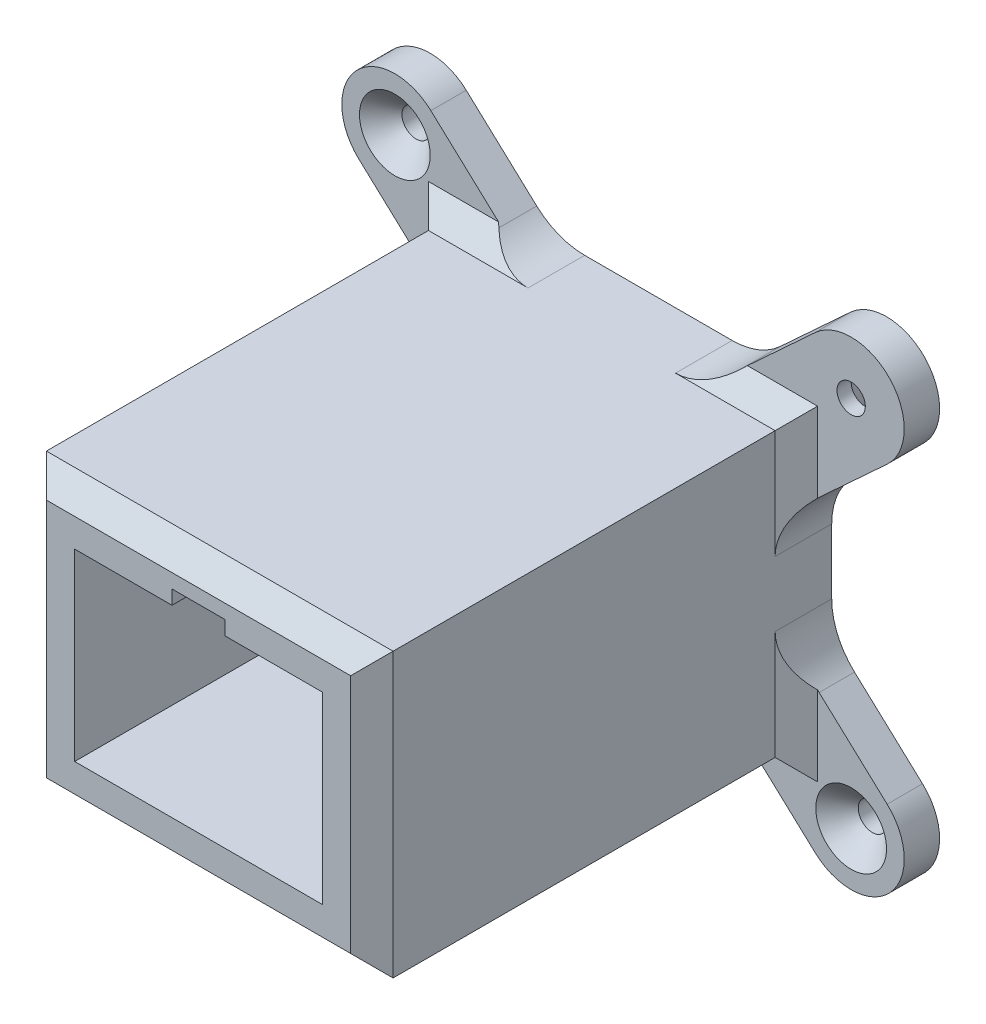
from build123d import *

# Parameters (mm, degrees)
SKETCH1_W               = 49
SKETCH1_H               = 40
BOSS_EXTRUDE1_DEPTH     = 60
SKETCH2_W               = 49
SKETCH2_H               = 40
BOSS_EXTRUDE2_DEPTH     = 5
SKETCH3_R               = 3.75
SKETCH3_W               = 8
SKETCH3_H               = 8
CUT_EXTRUDE1_DEPTH      = 4
SKETCH4_R               = 2
BOSS_EXTRUDE3_DEPTH     = 5
MIRROR2_COPY_1_SKETCH_R = 2
MIRROR2_COPY_1_DEPTH    = 5
CHAMFER2_SIZE           = 3
FILLET1_R               = 10
CHAMFER3_SIZE           = 3


with BuildPart() as part:
    # Sketch1 → Boss-Extrude1 (new body)
    with BuildSketch(Plane.XY):
        Rectangle(SKETCH1_W, SKETCH1_H)
        Polygon((-17.5, -13), (17.5, -13), (17.5, 13), (3.75, 13), (3.75, 15), (-3.75, 15), (-3.75, 13), (-17.5, 13), align=None, mode=Mode.SUBTRACT)
    extrude(amount=BOSS_EXTRUDE1_DEPTH)

    # Sketch2 → Boss-Extrude2 (add)
    with BuildSketch(Plane.XY):
        Rectangle(SKETCH2_W, SKETCH2_H)
    extrude(amount=-BOSS_EXTRUDE2_DEPTH)

    # Sketch3 → Cut-Extrude1 (cut)
    with BuildSketch(Plane.XY):
        with Locations((12, 0.25)):
            Circle(SKETCH3_R)
        with Locations((-12, 0.25)):
            Circle(SKETCH3_R)
        Rectangle(SKETCH3_W, SKETCH3_H)
    extrude(amount=-CUT_EXTRUDE1_DEPTH, mode=Mode.SUBTRACT)

    # Sketch4 → Boss-Extrude3 (add)
    with BuildSketch(Plane(origin=(0, 0, -5), x_dir=(-1, 0, 0), z_dir=(0, 0, -1))):
        with BuildLine():
            Line((27.161413951, 31.836546483), (14.329603899, 20))
            Line((14.329603899, 20), (24.5, 8.974436833))
            Line((24.5, 8.974436833), (37.331810052, 20.810983316))
            ThreePointArc((37.331810052, 20.810983316), (37.759393585, 31.40896295), (27.161413951, 31.836546483))
        make_face()
        with Locations((32.246612001, 26.323764899)):
            Circle(SKETCH4_R, mode=Mode.SUBTRACT)
    boss_extrude3 = extrude(amount=-BOSS_EXTRUDE3_DEPTH)

    # Mirror1: Boss-Extrude3 across plane
    add(boss_extrude3.mirror(Plane.ZX))

    # Mirror2: Boss-Extrude3 across plane
    add(boss_extrude3.mirror(Plane(origin=(0, 0, 0), x_dir=(0, 0, 1), z_dir=(1, 0, 0))))

    # Mirror2 copy 1 sketch → Mirror2 copy 1 (add)
    with BuildSketch(Plane(origin=(0, 0, -5), x_dir=(1, 0, 0), z_dir=(0, 0, -1))):
        with BuildLine():
            Line((27.161413951, 31.836546483), (14.329603899, 20))
            Line((14.329603899, 20), (24.5, 8.974436833))
            Line((24.5, 8.974436833), (37.331810052, 20.810983316))
            ThreePointArc((37.331810052, 20.810983316), (37.759393585, 31.40896295), (27.161413951, 31.836546483))
        make_face()
        with Locations((32.246612001, 26.323764899)):
            Circle(MIRROR2_COPY_1_SKETCH_R, mode=Mode.SUBTRACT)
    extrude(amount=-MIRROR2_COPY_1_DEPTH)

    # Chamfer2
    chamfer2_edges = [part.edges().sort_by_distance(p)[0] for p in [
        (-30.246612001, -26.323764899, 0),
        (24.5, -14.487218417, 0),
        (30.246612001, -26.323764899, 0),
        (19.414801949, -20, 0),
        (19.414801949, 20, 0),
        (24.5, 14.487218417, 0),
        (30.246612001, 26.323764899, -5),
        (-19.414801949, 20, 0),
        (-30.246612001, 26.323764899, 0),
        (-24.5, 14.487218417, 0),
        (-19.414801949, -20, 0),
        (-24.5, -14.487218417, 0),
    ]]
    chamfer(chamfer2_edges, length=CHAMFER2_SIZE)

    # Fillet1
    # the kernel refuses this fillet: 10 mm, written as the material it adds along each edge
    with BuildSketch(Plane(origin=(-14.329603899, -20, 12.769621541), x_dir=(1, 0, 0), z_dir=(0, 0, -1))) as fillet1_piece_1_section:
        with BuildLine():
            CenterArc((FILLET1_R * 0.390784861631, FILLET1_R), FILLET1_R, 227.310388658, 42.689611342)
            Line((-FILLET1_R * 0.287241545106, FILLET1_R * 0.264962455539), (0, 0))
            Line((0, 0), (FILLET1_R * 0.390784861631, 0))
        make_face()
    fillet1_piece_1 = extrude(amount=17.769621541, mode=Mode.PRIVATE)
    fillet1_piece_1 = split(fillet1_piece_1, bisect_by=Plane(origin=(-13.989510019, -22.368902141, 0.631097859), z_dir=(0, 0.7071067811865476, -0.7071067811865476)), keep=Keep.TOP, mode=Mode.PRIVATE)
    add(fillet1_piece_1)
    with BuildSketch(Plane(origin=(14.329603899, -20, -5), x_dir=(-1, 0, 0), z_dir=(0, 0, 1))) as fillet1_piece_2_section:
        with BuildLine():
            CenterArc((FILLET1_R * 0.390784861631, FILLET1_R), FILLET1_R, 227.310388658, 42.689611342)
            Line((-FILLET1_R * 0.287241545106, FILLET1_R * 0.264962455539), (0, 0))
            Line((0, 0), (FILLET1_R * 0.390784861631, 0))
        make_face()
    fillet1_piece_2 = extrude(amount=17.769621541, mode=Mode.PRIVATE)
    fillet1_piece_2 = split(fillet1_piece_2, bisect_by=Plane(origin=(13.989510019, -22.368902141, 0.631097859), z_dir=(0, 0.7071067811865476, -0.7071067811865476)), keep=Keep.TOP, mode=Mode.PRIVATE)
    add(fillet1_piece_2)
    with BuildSketch(Plane(origin=(-24.5, 8.974436833, 13.950923381), x_dir=(-0.7350375444611025, 0.6780264067369298, 0), z_dir=(0, 0, -1))) as fillet1_piece_3_section:
        with BuildLine():
            CenterArc((FILLET1_R * 0.438036935241, -FILLET1_R), FILLET1_R, 90, 47.310388658)
            Line((-FILLET1_R * 0.29700060922, -FILLET1_R * 0.321973593263), (0, 0))
            Line((0, 0), (FILLET1_R * 0.438036935241, 0))
        make_face()
    fillet1_piece_3 = extrude(amount=18.950923381, mode=Mode.PRIVATE)
    fillet1_piece_3 = split(fillet1_piece_3, bisect_by=Plane(origin=(-24.902442497, 8.18834841, 0), z_dir=(0, 0, 1)), keep=Keep.TOP, mode=Mode.PRIVATE)
    fillet1_piece_3 = split(fillet1_piece_3, bisect_by=Plane(origin=(-25.551831873, 8.18834841, 1.948168127), z_dir=(0.7071067811865476, 0, -0.7071067811865476)), keep=Keep.TOP, mode=Mode.PRIVATE)
    add(fillet1_piece_3)
    with BuildSketch(Plane(origin=(-24.5, 8.974436833, 13.950923381), x_dir=(-0.7350375444611025, 0.6780264067369298, 0), z_dir=(0, 0, -1))) as fillet1_piece_4_section:
        with BuildLine():
            CenterArc((FILLET1_R * 0.438036935241, -FILLET1_R), FILLET1_R, 90, 47.310388658)
            Line((-FILLET1_R * 0.29700060922, -FILLET1_R * 0.321973593263), (0, 0))
            Line((0, 0), (FILLET1_R * 0.438036935241, 0))
        make_face()
    fillet1_piece_4 = extrude(amount=18.950923381, mode=Mode.PRIVATE)
    fillet1_piece_4 = split(fillet1_piece_4, bisect_by=Plane(origin=(-27.613706102, 11.943996137, 0), z_dir=(0, 0, -1)), keep=Keep.TOP, mode=Mode.PRIVATE)
    fillet1_piece_4 = split(fillet1_piece_4, bisect_by=Plane(origin=(-27.585279578, 11.943996137, -0.085279578), z_dir=(-0.7071067811865476, 0, 0.7071067811865476)), keep=Keep.TOP, mode=Mode.PRIVATE)
    add(fillet1_piece_4)
    with BuildSketch(Plane(origin=(-24.5, 8.974436833, 13.950923381), x_dir=(-0.7350375444611025, 0.6780264067369298, 0), z_dir=(0, 0, -1))) as fillet1_piece_5_section:
        with BuildLine():
            CenterArc((FILLET1_R * 0.438036935241, -FILLET1_R), FILLET1_R, 90, 47.310388658)
            Line((-FILLET1_R * 0.29700060922, -FILLET1_R * 0.321973593263), (0, 0))
            Line((0, 0), (FILLET1_R * 0.438036935241, 0))
        make_face()
    fillet1_piece_5 = extrude(amount=18.950923381, mode=Mode.PRIVATE)
    fillet1_piece_5 = split(fillet1_piece_5, bisect_by=Plane(origin=(-25.183285412, 8.674450436, 0), z_dir=(0, 0, -1)), keep=Keep.TOP, mode=Mode.PRIVATE)
    fillet1_piece_5 = split(fillet1_piece_5, bisect_by=Plane(origin=(-27.591834999, 8.674450436, -0.091834999), z_dir=(0.7071067811865476, 0, -0.7071067811865476)), keep=Keep.TOP, mode=Mode.PRIVATE)
    add(fillet1_piece_5)
    with BuildSketch(Plane(origin=(-24.5, -8.974436833, -5), x_dir=(-0.7350375444611025, -0.6780264067369298, 0), z_dir=(0, 0, 1))) as fillet1_piece_6_section:
        with BuildLine():
            CenterArc((FILLET1_R * 0.438036935241, -FILLET1_R), FILLET1_R, 90, 47.310388658)
            Line((-FILLET1_R * 0.29700060922, -FILLET1_R * 0.321973593263), (0, 0))
            Line((0, 0), (FILLET1_R * 0.438036935241, 0))
        make_face()
    fillet1_piece_6 = extrude(amount=18.950923381, mode=Mode.PRIVATE)
    fillet1_piece_6 = split(fillet1_piece_6, bisect_by=Plane(origin=(-25.183285412, -8.674450436, 0), z_dir=(0, 0, -1)), keep=Keep.TOP, mode=Mode.PRIVATE)
    fillet1_piece_6 = split(fillet1_piece_6, bisect_by=Plane(origin=(-27.591834999, -8.674450436, -0.091834999), z_dir=(0.7071067811865476, 0, -0.7071067811865476)), keep=Keep.TOP, mode=Mode.PRIVATE)
    add(fillet1_piece_6)
    with BuildSketch(Plane(origin=(-24.5, -8.974436833, -5), x_dir=(-0.7350375444611025, -0.6780264067369298, 0), z_dir=(0, 0, 1))) as fillet1_piece_7_section:
        with BuildLine():
            CenterArc((FILLET1_R * 0.438036935241, -FILLET1_R), FILLET1_R, 90, 47.310388658)
            Line((-FILLET1_R * 0.29700060922, -FILLET1_R * 0.321973593263), (0, 0))
            Line((0, 0), (FILLET1_R * 0.438036935241, 0))
        make_face()
    fillet1_piece_7 = extrude(amount=18.950923381, mode=Mode.PRIVATE)
    fillet1_piece_7 = split(fillet1_piece_7, bisect_by=Plane(origin=(-24.902442497, -8.18834841, 0), z_dir=(0, 0, 1)), keep=Keep.TOP, mode=Mode.PRIVATE)
    fillet1_piece_7 = split(fillet1_piece_7, bisect_by=Plane(origin=(-25.551831873, -8.18834841, 1.948168127), z_dir=(0.7071067811865476, 0, -0.7071067811865476)), keep=Keep.TOP, mode=Mode.PRIVATE)
    add(fillet1_piece_7)
    with BuildSketch(Plane(origin=(-24.5, -8.974436833, -5), x_dir=(-0.7350375444611025, -0.6780264067369298, 0), z_dir=(0, 0, 1))) as fillet1_piece_8_section:
        with BuildLine():
            CenterArc((FILLET1_R * 0.438036935241, -FILLET1_R), FILLET1_R, 90, 47.310388658)
            Line((-FILLET1_R * 0.29700060922, -FILLET1_R * 0.321973593263), (0, 0))
            Line((0, 0), (FILLET1_R * 0.438036935241, 0))
        make_face()
    fillet1_piece_8 = extrude(amount=18.950923381, mode=Mode.PRIVATE)
    fillet1_piece_8 = split(fillet1_piece_8, bisect_by=Plane(origin=(-27.613706102, -11.943996137, 0), z_dir=(0, 0, -1)), keep=Keep.TOP, mode=Mode.PRIVATE)
    fillet1_piece_8 = split(fillet1_piece_8, bisect_by=Plane(origin=(-27.585279578, -11.943996137, -0.085279578), z_dir=(-0.7071067811865476, 0, 0.7071067811865476)), keep=Keep.TOP, mode=Mode.PRIVATE)
    add(fillet1_piece_8)
    with BuildSketch(Plane(origin=(-14.329603899, 20, -5), x_dir=(1, 0, 0), z_dir=(0, 0, 1))) as fillet1_piece_9_section:
        with BuildLine():
            CenterArc((FILLET1_R * 0.390784861631, FILLET1_R), FILLET1_R, 227.310388658, 42.689611342)
            Line((-FILLET1_R * 0.287241545106, FILLET1_R * 0.264962455539), (0, 0))
            Line((0, 0), (FILLET1_R * 0.390784861631, 0))
        make_face()
    fillet1_piece_9 = extrude(amount=17.769621541, mode=Mode.PRIVATE)
    fillet1_piece_9 = split(fillet1_piece_9, bisect_by=Plane(origin=(-13.989510019, 22.368902141, 0.631097859), z_dir=(0, -0.7071067811865476, -0.7071067811865476)), keep=Keep.TOP, mode=Mode.PRIVATE)
    add(fillet1_piece_9)
    with BuildSketch(Plane(origin=(14.329603899, 20, 12.769621541), x_dir=(0.7350375444611016, 0.6780264067369309, 0), z_dir=(0, 0, -1))) as fillet1_piece_10_section:
        with BuildLine():
            CenterArc((FILLET1_R * 0.390784861631, -FILLET1_R), FILLET1_R, 90, 42.689611342)
            Line((-FILLET1_R * 0.287241545106, -FILLET1_R * 0.264962455539), (0, 0))
            Line((0, 0), (FILLET1_R * 0.390784861631, 0))
        make_face()
    fillet1_piece_10 = extrude(amount=17.769621541, mode=Mode.PRIVATE)
    fillet1_piece_10 = split(fillet1_piece_10, bisect_by=Plane(origin=(13.989510019, 22.368902141, 0.631097859), z_dir=(0, -0.7071067811865476, -0.7071067811865476)), keep=Keep.TOP, mode=Mode.PRIVATE)
    add(fillet1_piece_10)
    with BuildSketch(Plane(origin=(24.5, 8.974436833, -5), x_dir=(0.7350375444611025, 0.6780264067369298, 0), z_dir=(0, 0, 1))) as fillet1_piece_11_section:
        with BuildLine():
            CenterArc((FILLET1_R * 0.438036935241, -FILLET1_R), FILLET1_R, 90, 47.310388658)
            Line((-FILLET1_R * 0.29700060922, -FILLET1_R * 0.321973593263), (0, 0))
            Line((0, 0), (FILLET1_R * 0.438036935241, 0))
        make_face()
    fillet1_piece_11 = extrude(amount=18.950923381, mode=Mode.PRIVATE)
    fillet1_piece_11 = split(fillet1_piece_11, bisect_by=Plane(origin=(25.183285412, 8.674450436, 0), z_dir=(0, 0, -1)), keep=Keep.TOP, mode=Mode.PRIVATE)
    fillet1_piece_11 = split(fillet1_piece_11, bisect_by=Plane(origin=(27.591834999, 8.674450436, -0.091834999), z_dir=(-0.7071067811865476, 0, -0.7071067811865476)), keep=Keep.TOP, mode=Mode.PRIVATE)
    add(fillet1_piece_11)
    with BuildSketch(Plane(origin=(24.5, 8.974436833, -5), x_dir=(0.7350375444611025, 0.6780264067369298, 0), z_dir=(0, 0, 1))) as fillet1_piece_12_section:
        with BuildLine():
            CenterArc((FILLET1_R * 0.438036935241, -FILLET1_R), FILLET1_R, 90, 47.310388658)
            Line((-FILLET1_R * 0.29700060922, -FILLET1_R * 0.321973593263), (0, 0))
            Line((0, 0), (FILLET1_R * 0.438036935241, 0))
        make_face()
    fillet1_piece_12 = extrude(amount=18.950923381, mode=Mode.PRIVATE)
    fillet1_piece_12 = split(fillet1_piece_12, bisect_by=Plane(origin=(24.902442497, 8.18834841, 0), z_dir=(0, 0, 1)), keep=Keep.TOP, mode=Mode.PRIVATE)
    fillet1_piece_12 = split(fillet1_piece_12, bisect_by=Plane(origin=(25.551831873, 8.18834841, 1.948168127), z_dir=(-0.7071067811865476, 0, -0.7071067811865476)), keep=Keep.TOP, mode=Mode.PRIVATE)
    add(fillet1_piece_12)
    with BuildSketch(Plane(origin=(24.5, 8.974436833, -5), x_dir=(0.7350375444611025, 0.6780264067369298, 0), z_dir=(0, 0, 1))) as fillet1_piece_13_section:
        with BuildLine():
            CenterArc((FILLET1_R * 0.438036935241, -FILLET1_R), FILLET1_R, 90, 47.310388658)
            Line((-FILLET1_R * 0.29700060922, -FILLET1_R * 0.321973593263), (0, 0))
            Line((0, 0), (FILLET1_R * 0.438036935241, 0))
        make_face()
    fillet1_piece_13 = extrude(amount=18.950923381, mode=Mode.PRIVATE)
    fillet1_piece_13 = split(fillet1_piece_13, bisect_by=Plane(origin=(27.613706102, 11.943996137, 0), z_dir=(0, 0, -1)), keep=Keep.TOP, mode=Mode.PRIVATE)
    fillet1_piece_13 = split(fillet1_piece_13, bisect_by=Plane(origin=(27.585279578, 11.943996137, -0.085279578), z_dir=(0.7071067811865476, 0, 0.7071067811865476)), keep=Keep.TOP, mode=Mode.PRIVATE)
    add(fillet1_piece_13)
    with BuildSketch(Plane(origin=(24.5, -8.974436833, 13.950923381), x_dir=(0.7350375444611025, -0.6780264067369298, 0), z_dir=(0, 0, -1))) as fillet1_piece_14_section:
        with BuildLine():
            CenterArc((FILLET1_R * 0.438036935241, -FILLET1_R), FILLET1_R, 90, 47.310388658)
            Line((-FILLET1_R * 0.29700060922, -FILLET1_R * 0.321973593263), (0, 0))
            Line((0, 0), (FILLET1_R * 0.438036935241, 0))
        make_face()
    fillet1_piece_14 = extrude(amount=18.950923381, mode=Mode.PRIVATE)
    fillet1_piece_14 = split(fillet1_piece_14, bisect_by=Plane(origin=(24.902442497, -8.18834841, 0), z_dir=(0, 0, 1)), keep=Keep.TOP, mode=Mode.PRIVATE)
    fillet1_piece_14 = split(fillet1_piece_14, bisect_by=Plane(origin=(25.551831873, -8.18834841, 1.948168127), z_dir=(-0.7071067811865476, 0, -0.7071067811865476)), keep=Keep.TOP, mode=Mode.PRIVATE)
    add(fillet1_piece_14)
    with BuildSketch(Plane(origin=(24.5, -8.974436833, 13.950923381), x_dir=(0.7350375444611025, -0.6780264067369298, 0), z_dir=(0, 0, -1))) as fillet1_piece_15_section:
        with BuildLine():
            CenterArc((FILLET1_R * 0.438036935241, -FILLET1_R), FILLET1_R, 90, 47.310388658)
            Line((-FILLET1_R * 0.29700060922, -FILLET1_R * 0.321973593263), (0, 0))
            Line((0, 0), (FILLET1_R * 0.438036935241, 0))
        make_face()
    fillet1_piece_15 = extrude(amount=18.950923381, mode=Mode.PRIVATE)
    fillet1_piece_15 = split(fillet1_piece_15, bisect_by=Plane(origin=(27.613706102, -11.943996137, 0), z_dir=(0, 0, -1)), keep=Keep.TOP, mode=Mode.PRIVATE)
    fillet1_piece_15 = split(fillet1_piece_15, bisect_by=Plane(origin=(27.585279578, -11.943996137, -0.085279578), z_dir=(0.7071067811865476, 0, 0.7071067811865476)), keep=Keep.TOP, mode=Mode.PRIVATE)
    add(fillet1_piece_15)
    with BuildSketch(Plane(origin=(24.5, -8.974436833, 13.950923381), x_dir=(0.7350375444611025, -0.6780264067369298, 0), z_dir=(0, 0, -1))) as fillet1_piece_16_section:
        with BuildLine():
            CenterArc((FILLET1_R * 0.438036935241, -FILLET1_R), FILLET1_R, 90, 47.310388658)
            Line((-FILLET1_R * 0.29700060922, -FILLET1_R * 0.321973593263), (0, 0))
            Line((0, 0), (FILLET1_R * 0.438036935241, 0))
        make_face()
    fillet1_piece_16 = extrude(amount=18.950923381, mode=Mode.PRIVATE)
    fillet1_piece_16 = split(fillet1_piece_16, bisect_by=Plane(origin=(25.183285412, -8.674450436, 0), z_dir=(0, 0, -1)), keep=Keep.TOP, mode=Mode.PRIVATE)
    fillet1_piece_16 = split(fillet1_piece_16, bisect_by=Plane(origin=(27.591834999, -8.674450436, -0.091834999), z_dir=(-0.7071067811865476, 0, -0.7071067811865476)), keep=Keep.TOP, mode=Mode.PRIVATE)
    add(fillet1_piece_16)

    # Chamfer3
    chamfer3_edges = [part.edges().sort_by_distance(p)[0] for p in [
        (24.5, 0, 60),
        (0, 20, 60),
        (-24.5, 0, 60),
        (0, -20, 60),
    ]]
    chamfer(chamfer3_edges, length=CHAMFER3_SIZE)


solid = part.part
